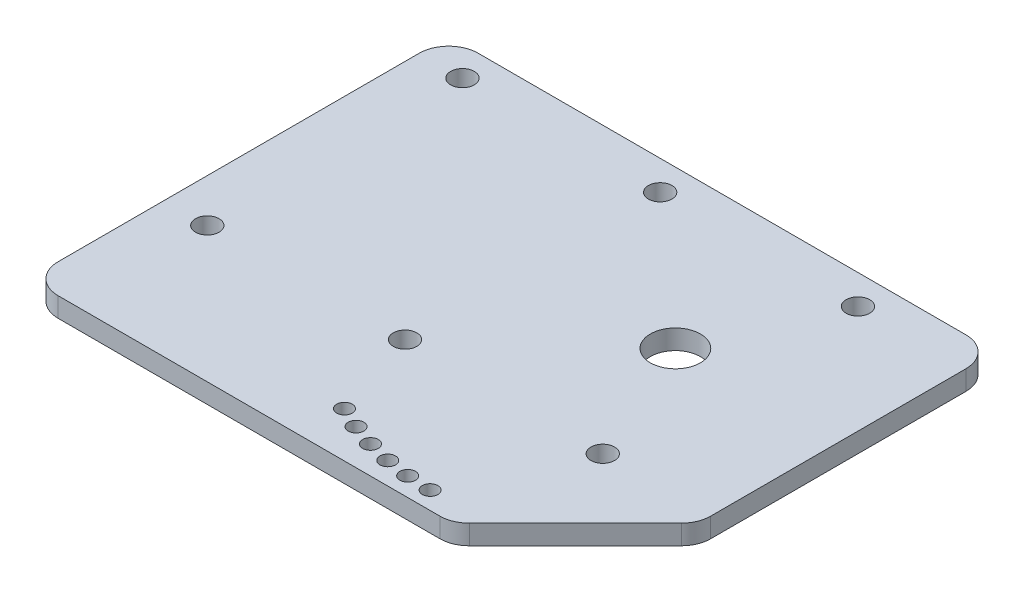
from build123d import *

# Parameters (mm, degrees)
BOSS_EXTRUDE1_DEPTH          = 10
F_12_0MM_DOWEL_HOLE1_D       = 12
F_25_5_25_5_DIAMETER_HOLE1_D = 25.5
F_5_16_0_3125_DOWEL_HOLE1_D  = 7.9375


with BuildPart() as part:
    # Sketch2 → Boss-Extrude1 (new body)
    with BuildSketch(Plane(origin=(0, 0, 0), x_dir=(1, 0, 0), z_dir=(0, 1, 0))):
        with BuildLine():
            Line((-195.5, 65), (-195.5, -119))
            ThreePointArc((-195.5, -119), (-191.106601718, -129.606601718), (-180.5, -134))
            Line((-180.5, -134), (14, -134))
            ThreePointArc((14, -134), (19.740251485, -132.858192988), (24.606601718, -129.606601718))
            Line((24.606601718, -129.606601718), (78.606601718, -75.606601718))
            ThreePointArc((78.606601718, -75.606601718), (81.858192988, -70.740251485), (83, -65))
            Line((83, -65), (83, 65))
            ThreePointArc((83, 65), (78.606601718, 75.606601718), (68, 80))
            Line((68, 80), (-180.5, 80))
            ThreePointArc((-180.5, 80), (-191.106601718, 75.606601718), (-195.5, 65))
        make_face()
    extrude(amount=BOSS_EXTRUDE1_DEPTH)

    # Ø12.0mm Dowel Hole1 (through all)
    with Locations(Plane(origin=(0, 10, 0), x_dir=(1, 0, 0), z_dir=(0, 1, 0))):
        with Locations((-173.5, 65), (-72.75, 65), (-173.5, -65), (-72.75, -65), (28, -65), (28, 65)):
            Hole(F_12_0MM_DOWEL_HOLE1_D / 2)

    # Ø25.5 (25.5) Diameter Hole1 (through all)
    with Locations(Plane(origin=(0, 10, 0), x_dir=(1, 0, 0), z_dir=(0, 1, 0))):
        with Locations((0, 0)):
            Hole(F_25_5_25_5_DIAMETER_HOLE1_D / 2)

    # 5/16 (0.3125) Dowel Hole1 (through all)
    with Locations(Plane(origin=(0, 10, 0), x_dir=(1, 0, 0), z_dir=(0, 1, 0))):
        with Locations((0, -125), (-11.980719065, -124.424524796), (-23.851124422, -122.703397931), (-35.501918088, -119.852466859), (-46.825824177, -115.897981821), (-57.718576654, -110.876354147)):
            Hole(F_5_16_0_3125_DOWEL_HOLE1_D / 2)


solid = part.part
